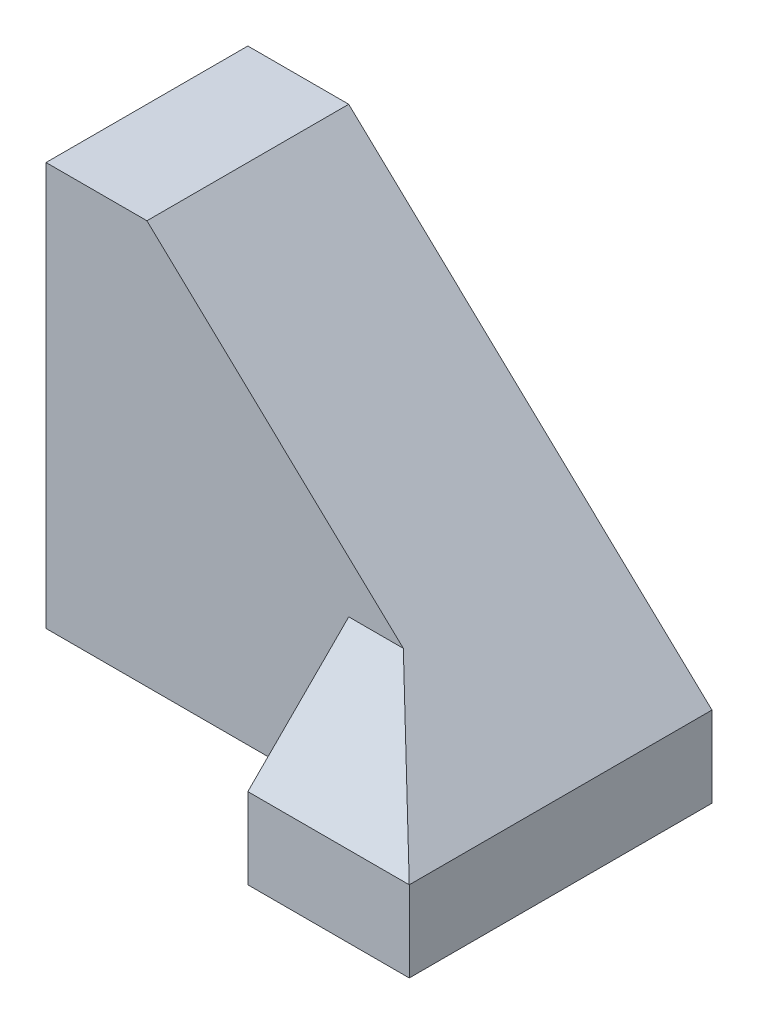
from build123d import *

# Parameters (mm, degrees)
EXTRUDE_1_DEPTH     = 10
SKETCH_2_R          = 1.85
CUT_EXTRUDE_1_DEPTH = 6
SKETCH_3_W          = 8
SKETCH_3_H          = 3
EXTRUDE_2_DEPTH     = 5
CHAMFER_2_SIZE      = 5
SKETCH_4_W          = 8
SKETCH_4_H          = 15
EXTRUDE_3_DEPTH     = 1


with BuildPart() as part:
    # ｽｹｯﾁ1 → ﾎﾞｽ - 押し出し1 (new body)
    with BuildSketch(Plane.XY):
        Polygon((0, 0), (0, 20), (5, 20), (23, 3), (23, 0), align=None)
    extrude(amount=EXTRUDE_1_DEPTH)

    # ｽｹｯﾁ2 → ｶｯﾄ - 押し出し1 (cut)
    with BuildSketch(Plane.ZY):
        with Locations((5, 15)):
            Circle(SKETCH_2_R)
        with Locations((5, 5)):
            Circle(SKETCH_2_R)
    extrude(amount=-CUT_EXTRUDE_1_DEPTH, mode=Mode.SUBTRACT)

    # ｽｹｯﾁ3 → ﾎﾞｽ - 押し出し2 (add)
    with BuildSketch(Plane.XY.offset(10)):
        with Locations((19, 1.5)):
            Rectangle(SKETCH_3_W, SKETCH_3_H)
    extrude(amount=EXTRUDE_2_DEPTH)

    # 面取り2
    chamfer_2_edges = [part.edges().sort_by_distance(p)[0] for p in [
        (19, 3, 10),
    ]]
    chamfer(chamfer_2_edges, length=CHAMFER_2_SIZE - 0.0001)  # a hair under: the kernel refuses the full size

    # ｽｹｯﾁ4 → ﾎﾞｽ - 押し出し3 (add)
    with BuildSketch(Plane(origin=(0, 0, 0), x_dir=(-1, 0, 0), z_dir=(0, -1, 0))):
        with Locations((-19, -7.5)):
            Rectangle(SKETCH_4_W, SKETCH_4_H)
    extrude(amount=EXTRUDE_3_DEPTH)


solid = part.part
